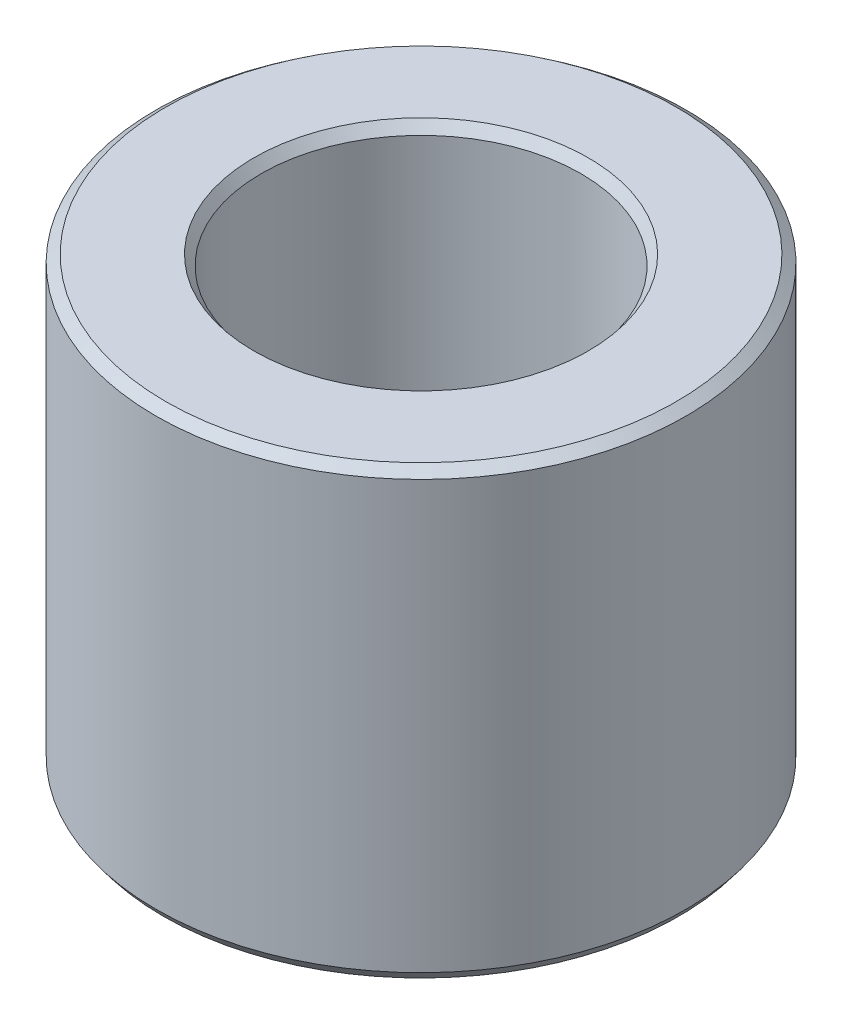
from build123d import *
from OCP.BRepFilletAPI import BRepFilletAPI_MakeChamfer

# Parameters (mm, degrees)
SKETCH1_R           = 52.5
BOSS_EXTRUDE1_DEPTH = 88.032663346
SKETCH2_R           = 31.646573192
CUT_EXTRUDE1_DEPTH  = 116.161841839
CHAMFER1_SIZE       = 1.483195981
CHAMFER1_SIZE2      = 1.96702247


with BuildPart() as part:
    # Sketch1 → Boss-Extrude1 (new body)
    with BuildSketch(Plane(origin=(0, 0, 0), x_dir=(1, 0, 0), z_dir=(0, 1, 0))):
        Circle(SKETCH1_R)
    extrude(amount=BOSS_EXTRUDE1_DEPTH)

    # Sketch2 → Cut-Extrude1 (cut, through all)
    with BuildSketch(Plane(origin=(0, 0, 0), x_dir=(1, 0, 0), z_dir=(0, 1, 0))):
        Circle(SKETCH2_R)
    extrude(amount=CUT_EXTRUDE1_DEPTH, mode=Mode.SUBTRACT)

    # Chamfer1: one chamfer whose edges measure the first distance from different faces: ONE call of the kernel's chamfer builder (chamfer() names one face for all edges)
    chamfer1_edges_1 = [part.edges().sort_by_distance(p)[0] for p in [
        (-31.646573192, 88.032663346, 0),
    ]]
    chamfer1_side_1 = [part.faces().sort_by_distance(p)[0] for p in [
        (-51.01507576, 88.032663346, 0),
    ]]
    chamfer1_edges_2 = [part.edges().sort_by_distance(p)[0] for p in [
        (-31.646573192, 0, 0),
    ]]
    chamfer1_side_2 = [part.faces().sort_by_distance(p)[0] for p in [
        (-31.646573192, 44.016331673, 0),
    ]]
    chamfer1_edges_3 = [part.edges().sort_by_distance(p)[0] for p in [
        (-52.5, 0, 0),
    ]]
    chamfer1_side_3 = [part.faces().sort_by_distance(p)[0] for p in [
        (-51.01507576, 0, 0),
    ]]
    chamfer1_edges_4 = [part.edges().sort_by_distance(p)[0] for p in [
        (-52.5, 88.032663346, 0),
    ]]
    chamfer1_side_4 = [part.faces().sort_by_distance(p)[0] for p in [
        (-52.5, 44.016331673, 0),
    ]]
    chamfer1 = BRepFilletAPI_MakeChamfer(part.part.solid().wrapped)
    for e in chamfer1_edges_1:
        chamfer1.Add(CHAMFER1_SIZE, CHAMFER1_SIZE2, e.wrapped, chamfer1_side_1[0].wrapped)  # the first distance lies on this face
    for e in chamfer1_edges_2:
        chamfer1.Add(CHAMFER1_SIZE, CHAMFER1_SIZE2, e.wrapped, chamfer1_side_2[0].wrapped)  # the first distance lies on this face
    for e in chamfer1_edges_3:
        chamfer1.Add(CHAMFER1_SIZE, CHAMFER1_SIZE2, e.wrapped, chamfer1_side_3[0].wrapped)  # the first distance lies on this face
    for e in chamfer1_edges_4:
        chamfer1.Add(CHAMFER1_SIZE, CHAMFER1_SIZE2, e.wrapped, chamfer1_side_4[0].wrapped)  # the first distance lies on this face
    add(Compound.cast(chamfer1.Shape()), mode=Mode.REPLACE)


solid = part.part
